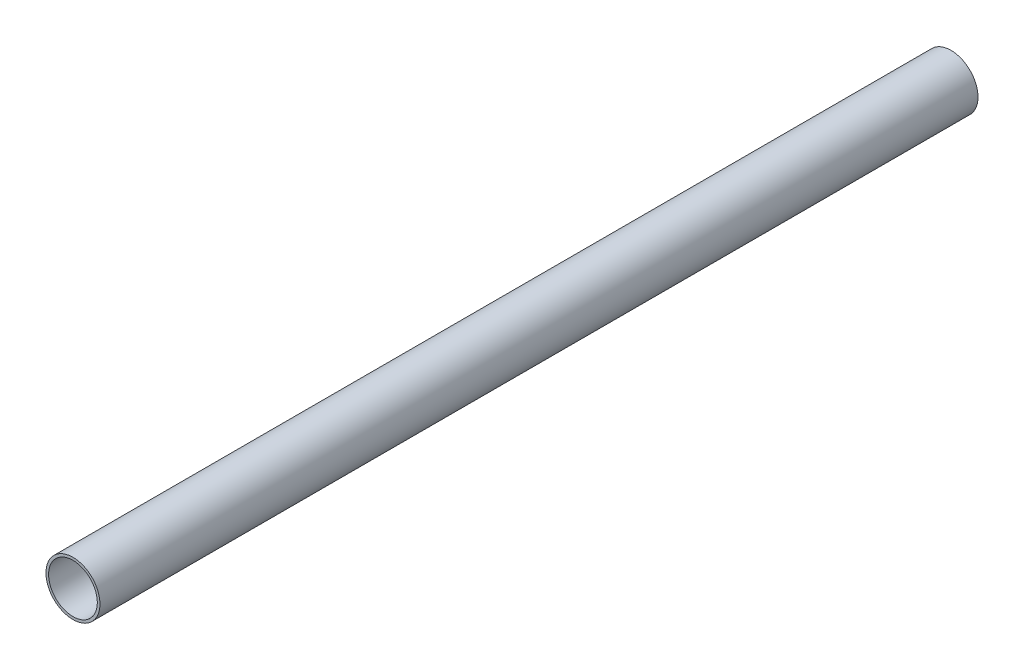
from build123d import *

# Parameters (mm, degrees)
SKETCH1_R           = 0.415
SKETCH1_R_2         = 0.375
BOSS_EXTRUDE1_DEPTH = 13.5
SCALE1_SCALE        = 6


with BuildPart() as part:
    # Sketch1 → Boss-Extrude1 (new body)
    with BuildSketch(Plane.XY):
        Circle(SKETCH1_R)
        Circle(SKETCH1_R_2, mode=Mode.SUBTRACT)
    extrude(amount=BOSS_EXTRUDE1_DEPTH)


with BuildPart() as part_1:
    # Scale1: scaled about (0, 0, 6.75)
    add(part.part.scale(SCALE1_SCALE).moved(Location((0, 0, -33.75))))


solid = part_1.part
